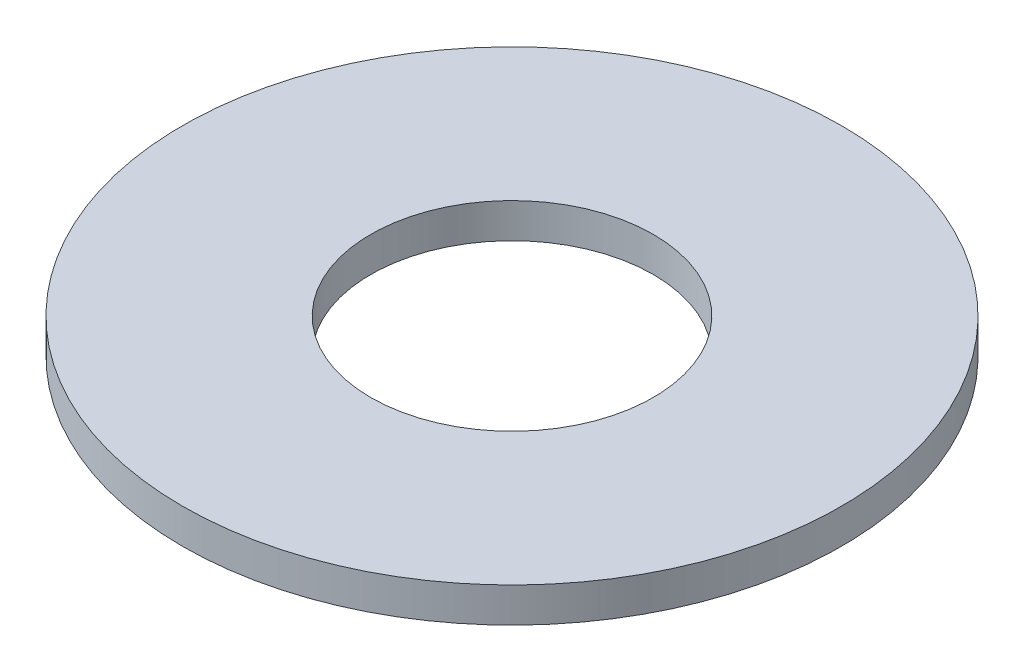
from build123d import *

# Parameters (mm, degrees)
SKETCH1_R           = 37.9
SKETCH1_R_2         = 16.25
BOSS_EXTRUDE1_DEPTH = 4


with BuildPart() as part:
    # Sketch1 → Boss-Extrude1 (new body)
    with BuildSketch(Plane(origin=(0, 0, 0), x_dir=(1, 0, 0), z_dir=(0, 1, 0))):
        Circle(SKETCH1_R)
        Circle(SKETCH1_R_2, mode=Mode.SUBTRACT)
    extrude(amount=BOSS_EXTRUDE1_DEPTH)


solid = part.part
